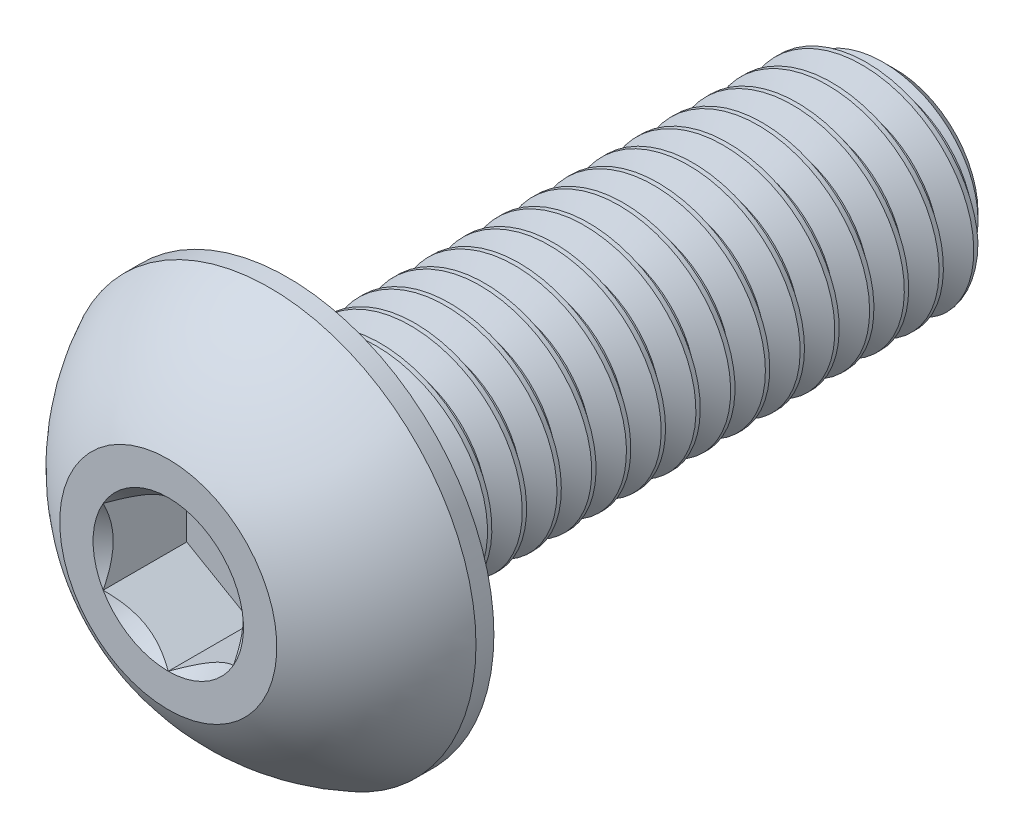
from build123d import *

# Parameters (mm, degrees)
CUT_EXTRUDE2_DEPTH = 1.925
CUT_SWEEP2_PITCH   = 0.8
CUT_SWEEP2_TO      = 14


with BuildPart() as part:
    # Sketch10 → Revolve3 (revolve)
    with BuildSketch(Plane(origin=(0, 0, 0), x_dir=(0, 0, -1), z_dir=(1, 0, 0)), mode=Mode.PRIVATE) as revolve3_sk:
        Polygon((16.15, 2.5), (16.75, 1.9), (16.75, 0), (2.75, 0), (2.75, 2.5), align=None)
    revolve(revolve3_sk.sketch.rotate(Axis((0, 0, 0), (0, 0, -1)), 90), axis=Axis((0, 0, 0), (0, 0, -1)))

    # Sketch7 → Revolve2 (revolve)
    with BuildSketch(Plane(origin=(0, 0, 0), x_dir=(0, 0, -1), z_dir=(1, 0, 0)), mode=Mode.PRIVATE) as revolve2_sk:
        with BuildLine():
            Line((2.3375, 4.75), (2.75, 4.75))
            Line((2.75, 4.75), (2.75, 0))
            Line((2.75, 0), (0, 0))
            Line((0, 0), (0, 2.5))
            ThreePointArc((0, 2.5), (0.991875183, 3.808753282), (2.3375, 4.75))
        make_face()
    revolve(revolve2_sk.sketch.rotate(Axis((0, 0, 0), (0, 0, -1)), 180), axis=Axis((0, 0, 0), (0, 0, -1)))

    # Sketch5 → Cut-Extrude2 (cut)
    with BuildSketch(Plane.XY):
        Polygon((1.5, -0.866025404), (1.5, 0.866025404), (0, 1.732050808), (-1.5, 0.866025404), (-1.5, -0.866025404), (0, -1.732050808), align=None)
    extrude(amount=-CUT_EXTRUDE2_DEPTH, mode=Mode.SUBTRACT)

    # Cut-Extrude3 cone 1 section (through the dimple's axis) → Cut-Extrude3 (revolve, cut)
    with BuildSketch(Plane(origin=(0, 0, 0), x_dir=(0, -1, 0), z_dir=(1, 0, 0))):
        Polygon((0, 0), (1.732050808, 0), (0, 1.732050808), align=None)
    revolve(axis=Axis((0, 0, 0), (0, 0, -1)), mode=Mode.SUBTRACT)


with BuildPart() as body_2:
    # Split1: read off the stored shape, not the designer's step
    # Split1: the piece on the far side of the plane
    add(part.part)
    split(bisect_by=Plane.XY.offset(-2.75), keep=Keep.BOTTOM)

    # Cut-Sweep2: arcs per turn and ends read off the stored shape
    # Cut-Sweep2: the profile of Sketch12 screwed along a right-hand helix through 22 turns, 8 arcs to a turn; built about Z, then put on its axis
    cut_sweep2_z = Axis((0, 0, 0), (0, 0, 1))
    cut_sweep2_corners = [(1.980384758, 0, -0.3), (1.980384758, 0, -0.4), (2.54330127, 0, -0.725), (2.54330127, 0, 0.025)]
    with BuildLine(mode=Mode.PRIVATE) as cut_sweep2_profile:
        Line(cut_sweep2_corners[0], cut_sweep2_corners[1])
        Line(cut_sweep2_corners[1], cut_sweep2_corners[2])
        Line(cut_sweep2_corners[2], cut_sweep2_corners[3])
        Line(cut_sweep2_corners[3], cut_sweep2_corners[0])
    cut_sweep2_cap = Face(cut_sweep2_profile.wire())
    cut_sweep2_turn_angles = [0, 22.5, 45, 67.5, 90, 112.5, 135, 157.5, 180, 202.5, 225, 247.5, 270, 292.5, 315, 337.5, 360]
    cut_sweep2_turn_weights = [1, 0.9238795325112867, 1, 0.9238795325112867, 1, 0.9238795325112867, 1, 0.9238795325112867, 1, 0.9238795325112867, 1, 0.9238795325112867, 1, 0.9238795325112867, 1, 0.9238795325112867, 1]
    cut_sweep2_turn_rails = [Edge.make_bspline([Vector(p[0], p[1], 0).rotate(cut_sweep2_z, cut_sweep2_turn_angles[k]) / cut_sweep2_turn_weights[k] + Vector(0, 0, p[2] + CUT_SWEEP2_PITCH * cut_sweep2_turn_angles[k] / 360) for k in range(17)], [0, 0, 0, 1, 1, 2, 2, 3, 3, 4, 4, 5, 5, 6, 6, 7, 7, 8, 8, 8], 2, cut_sweep2_turn_weights) for p in cut_sweep2_corners]
    cut_sweep2_turn_sides = [Face.make_surface_from_curves(cut_sweep2_turn_rails[p[0]], cut_sweep2_turn_rails[p[1]]) for p in [(0, 1), (1, 2), (2, 3), (3, 0)]]
    cut_sweep2 = Plane(origin=(0, 0, -16.75), x_dir=(0, 1, 0), z_dir=(0, 0, 1)) * split(Solid(Shell([*[p.moved(Location((0, 0, CUT_SWEEP2_PITCH * i))) for i in range(22) for p in cut_sweep2_turn_sides], cut_sweep2_cap, cut_sweep2_cap.rotate(cut_sweep2_z, 7920).moved(Location((0, 0, CUT_SWEEP2_PITCH * 7920 / 360)))])), bisect_by=Plane.XY.offset(CUT_SWEEP2_TO), keep=Keep.BOTTOM, mode=Mode.PRIVATE)
    add(cut_sweep2, mode=Mode.SUBTRACT)


with BuildPart() as part_1:
    add(part.part)

    # Split1
    split(bisect_by=Plane.XY.offset(-2.75), keep=Keep.TOP)

    add(body_2.part)  # Boss-Extrude1 merges body 2
    # Boss-Extrude1: read off the stored shape, not the designer's step
    # Boss-Extrude1 outline → Boss-Extrude1 (revolve)
    with BuildSketch(Plane.XZ):
        Polygon((1.980384758, -2.75), (1.980384758, -3.269615242), (2.5, -2.75), align=None)
    revolve(axis=Axis((0, 0, 0), (0, 0, 1)))


solid = part_1.part
